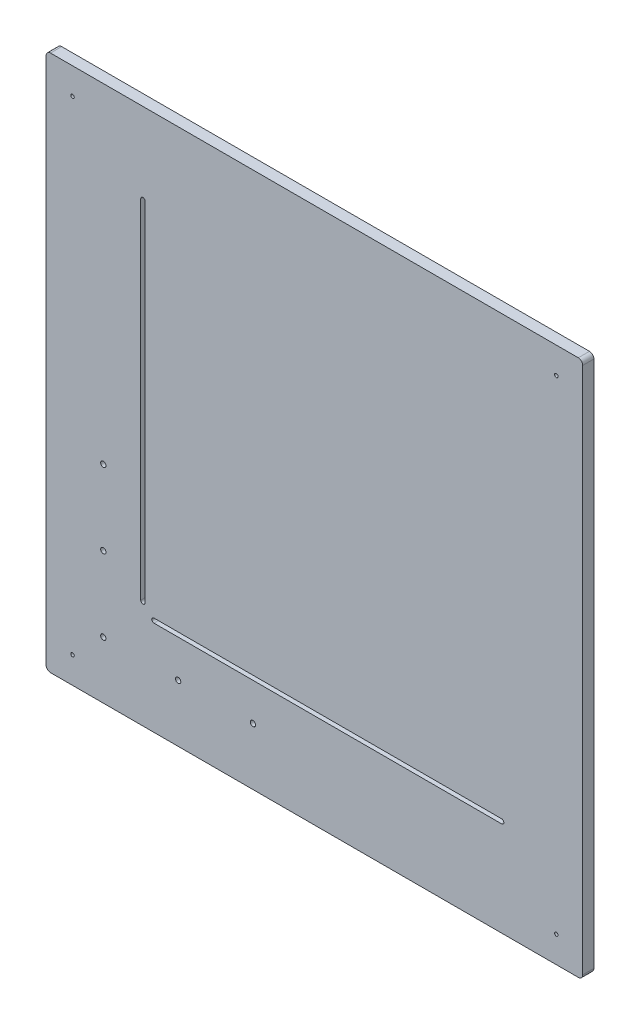
from build123d import *

# Parameters (mm, degrees)
SKETCH1_W                = 304.8
SKETCH1_H                = 304.8
BOSS_EXTRUDE1_DEPTH      = 6.35
M3_CLEARANCE_HOLE2_D     = 2
FILLET1_R                = 2.5
M3_CLEARANCE_SLOT1_DEPTH = 6.35
M3_CLEARANCE_SLOT2_DEPTH = 6.35
M3_CLEARANCE_HOLE1_D     = 3


# Read off the part's stored shape, not the designer's step: M3 Clearance Slot1, M3 Clearance Slot2
with BuildPart() as part:
    # Sketch1 → Boss-Extrude1 (new body)
    with BuildSketch(Plane.XY):
        Rectangle(SKETCH1_W, SKETCH1_H)
    extrude(amount=BOSS_EXTRUDE1_DEPTH)

    # M3 Clearance Hole2 (through all)
    with Locations(Plane.XY.offset(6.35)):
        with Locations((137.4, 137.4), (-137.4, -137.4), (137.4, -137.4), (-137.4, 137.4)):
            Hole(M3_CLEARANCE_HOLE2_D / 2)

    # Fillet1
    fillet1_edges = [part.edges().sort_by_distance(p)[0] for p in [
        (152.4, -152.4, 3.175),
        (-152.4, -152.4, 3.175),
        (-152.4, 152.4, 3.175),
        (152.4, 152.4, 3.175),
    ]]
    fillet(fillet1_edges, radius=FILLET1_R)

    # M3 Clearance Slot1 outline → M3 Clearance Slot1 (cut)
    with BuildSketch(Plane.XY):
        with BuildLine():
            Line((-91.15, -98.65), (106.35, -98.65))
            ThreePointArc((106.35, -98.65), (107.6, -97.4), (106.35, -96.15))
            Line((106.35, -96.15), (-91.15, -96.15))
            ThreePointArc((-91.15, -96.15), (-92.4, -97.4), (-91.15, -98.65))
        make_face()
    extrude(amount=M3_CLEARANCE_SLOT1_DEPTH, mode=Mode.SUBTRACT)

    # M3 Clearance Slot2 outline → M3 Clearance Slot2 (cut)
    with BuildSketch(Plane.XY):
        with BuildLine():
            Line((-98.65, 106.35), (-98.65, -91.15))
            ThreePointArc((-98.65, -91.15), (-97.4, -92.4), (-96.15, -91.15))
            Line((-96.15, -91.15), (-96.15, 106.35))
            ThreePointArc((-96.15, 106.35), (-97.4, 107.6), (-98.65, 106.35))
        make_face()
    extrude(amount=M3_CLEARANCE_SLOT2_DEPTH, mode=Mode.SUBTRACT)

    # M3 Clearance Hole1 (through all)
    with Locations(Plane.XY.offset(6.35)):
        with Locations((-34.9, -119.9), (-77.4, -119.9), (-119.9, -119.9), (-119.9, -77.4), (-119.9, -34.9)):
            Hole(M3_CLEARANCE_HOLE1_D / 2)


solid = part.part
